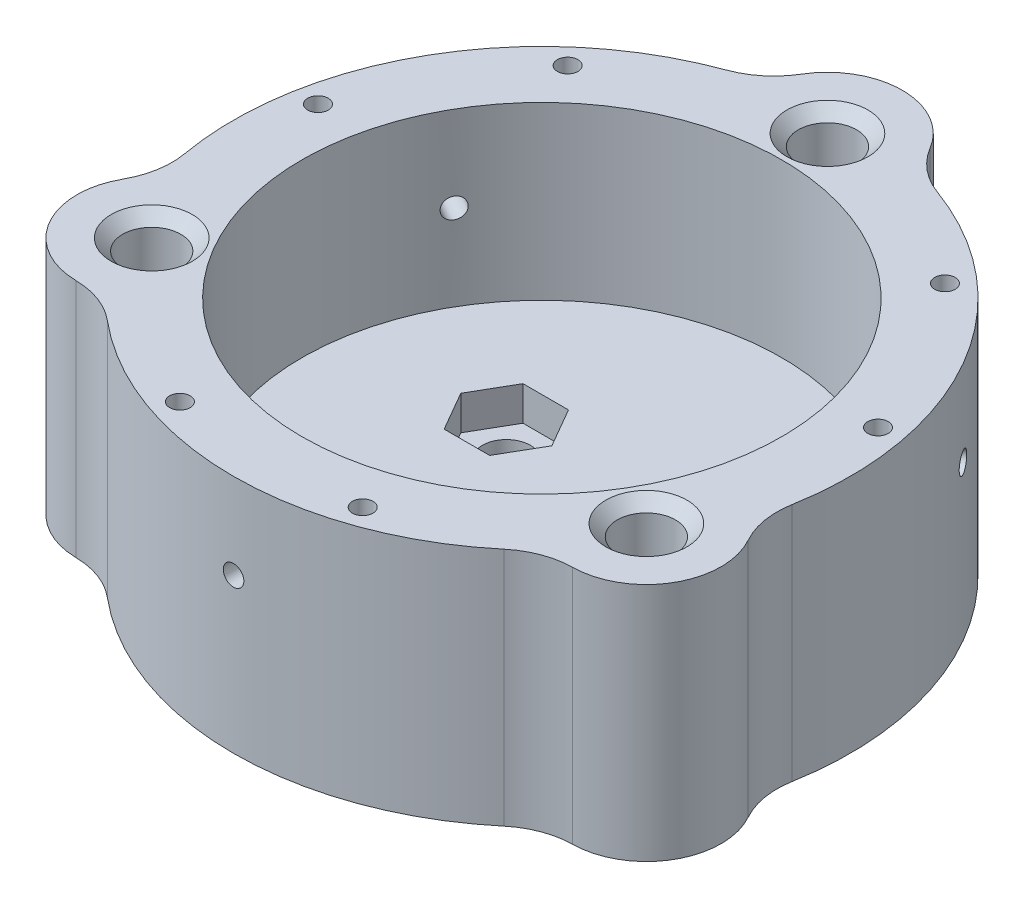
from build123d import *

# Parameters (mm, degrees)
SKETCH_1_R               = 2.55
SKETCH_1_R_2             = 21
EXTRUDE_1_DEPTH          = 15
EXTRUDE_START            = 6
EXTRUDE_2_DEPTH          = 6
FILLET_1_R               = 7
CHAMFER_1_SIZE           = 1
SKETCH_4_R               = 2.1
CUT_EXTRUDE_1_DEPTH      = 48.24064284
CUT_EXTRUDE_2_DEPTH      = 3
SKETCH_6_R               = 0.9
CUT_EXTRUDE_3_DEPTH      = 48.24064284
SKETCH_7_R               = 0.9
CUT_EXTRUDE_4_DEPTH      = 45.89630647
PATTERN_CIRCULAR_1_COUNT = 3


with BuildPart() as part:
    # Эскиз1 → Бобышка-Вытянуть1 (new body)
    with BuildSketch(Plane(origin=(0, 0, 0), x_dir=(1, 0, 0), z_dir=(0, 1, 0))):
        with BuildLine():
            ThreePointArc((6.435008795, 26.22195), (0, 31.55), (-6.435008795, 26.22195))
            ThreePointArc((-6.435008795, 26.22195), (-23.382685902, 13.5), (-25.926379234, -7.53809391))
            ThreePointArc((-25.926379234, -7.53809391), (-27.323101489, -15.775), (-19.491370439, -18.68385609))
            ThreePointArc((-19.491370439, -18.68385609), (0, -27), (19.491370439, -18.68385609))
            ThreePointArc((19.491370439, -18.68385609), (27.323101489, -15.775), (25.926379234, -7.53809391))
            ThreePointArc((25.926379234, -7.53809391), (23.382685902, 13.5), (6.435008795, 26.22195))
        make_face()
        with Locations((0, 25)):
            Circle(SKETCH_1_R, mode=Mode.SUBTRACT)
        Circle(SKETCH_1_R_2, mode=Mode.SUBTRACT)
        with Locations((21.650635095, -12.5)):
            Circle(SKETCH_1_R, mode=Mode.SUBTRACT)
        with Locations((-21.650635095, -12.5)):
            Circle(SKETCH_1_R, mode=Mode.SUBTRACT)
    extrude(amount=EXTRUDE_1_DEPTH)

    # Эскиз2 → Бобышка-Вытянуть2 (add)
    with BuildSketch(Plane.XZ.offset(EXTRUDE_START)):
        with BuildLine():
            ThreePointArc((25.926379234, 7.53809391), (27.323101489, 15.775), (19.491370439, 18.68385609))
            ThreePointArc((19.491370439, 18.68385609), (0, 27), (-19.491370439, 18.68385609))
            ThreePointArc((-19.491370439, 18.68385609), (-27.323101489, 15.775), (-25.926379234, 7.53809391))
            ThreePointArc((-25.926379234, 7.53809391), (-23.382685902, -13.5), (-6.435008795, -26.22195))
            ThreePointArc((-6.435008795, -26.22195), (0, -31.55), (6.435008795, -26.22195))
            ThreePointArc((6.435008795, -26.22195), (23.382685902, -13.5), (25.926379234, 7.53809391))
        make_face()
    extrude(amount=-EXTRUDE_2_DEPTH)

    # Скругление1
    fillet_1_edges = [part.edges().sort_by_distance(p)[0] for p in [
        (6.435008795, 4.5, -26.22195),
        (-6.435008795, 4.5, -26.22195),
        (-25.926379234, 4.5, 7.53809391),
        (-19.491370439, 4.5, 18.68385609),
        (19.491370439, 4.5, 18.68385609),
        (25.926379234, 4.5, 7.53809391),
    ]]
    fillet(fillet_1_edges, radius=FILLET_1_R)

    # Фаска1
    chamfer_1_edges = [part.edges().sort_by_distance(p)[0] for p in [
        (-2.55, 15, -25),
        (19.100635095, 15, 12.5),
        (-24.200635095, 15, 12.5),
    ]]
    chamfer(chamfer_1_edges, length=CHAMFER_1_SIZE)

    # Эскиз4 → Вырез-Вытянуть1 (cut, through all)
    with BuildSketch(Plane.XZ.offset(6)):
        with Locations((0, 8.5)):
            Circle(SKETCH_4_R)
        with Locations((7.361215932, -4.25)):
            Circle(SKETCH_4_R)
        with Locations((-7.361215932, -4.25)):
            Circle(SKETCH_4_R)
    extrude(amount=-CUT_EXTRUDE_1_DEPTH, mode=Mode.SUBTRACT)

    # Эскиз5 → Вырез-Вытянуть2 (cut)
    with BuildSketch(Plane(origin=(0, 0, 0), x_dir=(1, 0, 0), z_dir=(0, 1, 0))):
        Polygon((1.991858429, -11.95), (3.983716857, -8.5), (1.991858429, -5.05), (-1.991858429, -5.05), (-3.983716857, -8.5), (-1.991858429, -11.95), align=None)
        Polygon((5.369357503, 0.8), (9.353074361, 0.8), (11.34493279, 4.25), (9.353074361, 7.7), (5.369357503, 7.7), (3.377499075, 4.25), align=None)
        Polygon((-11.34493279, 4.25), (-9.353074361, 0.8), (-5.369357503, 0.8), (-3.377499075, 4.25), (-5.369357503, 7.7), (-9.353074361, 7.7), align=None)
    extrude(amount=-CUT_EXTRUDE_2_DEPTH, mode=Mode.SUBTRACT)

    # Эскиз6 → Вырез-Вытянуть3 (cut, through all)
    with BuildSketch(Plane(origin=(0, 15, 0), x_dir=(1, 0, 0), z_dir=(0, 1, 0))):
        with Locations((-8, -23.685438565)):
            Circle(SKETCH_6_R)
        with Locations((8, -23.685438565)):
            Circle(SKETCH_6_R)
        with Locations((-16.512191497, 18.770922513)):
            Circle(SKETCH_6_R)
        with Locations((-24.512191497, 4.914516052)):
            Circle(SKETCH_6_R)
        with Locations((24.512191497, 4.914516052)):
            Circle(SKETCH_6_R)
        with Locations((16.512191497, 18.770922513)):
            Circle(SKETCH_6_R)
    extrude(amount=-CUT_EXTRUDE_3_DEPTH, mode=Mode.SUBTRACT)

    # Эскиз7 → Вырез-Вытянуть4 (cut, through all)
    with BuildSketch(Plane.XY):
        with Locations((0, 7.5)):
            Circle(SKETCH_7_R)
    cut_extrude_4 = extrude(amount=CUT_EXTRUDE_4_DEPTH, mode=Mode.SUBTRACT)

    # Круговой массив1: Вырез-Вытянуть4 ×3 about axis
    pattern_circular_1_axis = Axis((0, 15, 0), (0, -1, 0))
    for i in range(1, PATTERN_CIRCULAR_1_COUNT):
        add(cut_extrude_4.rotate(pattern_circular_1_axis, i * 360 / PATTERN_CIRCULAR_1_COUNT), mode=Mode.SUBTRACT)


solid = part.part
